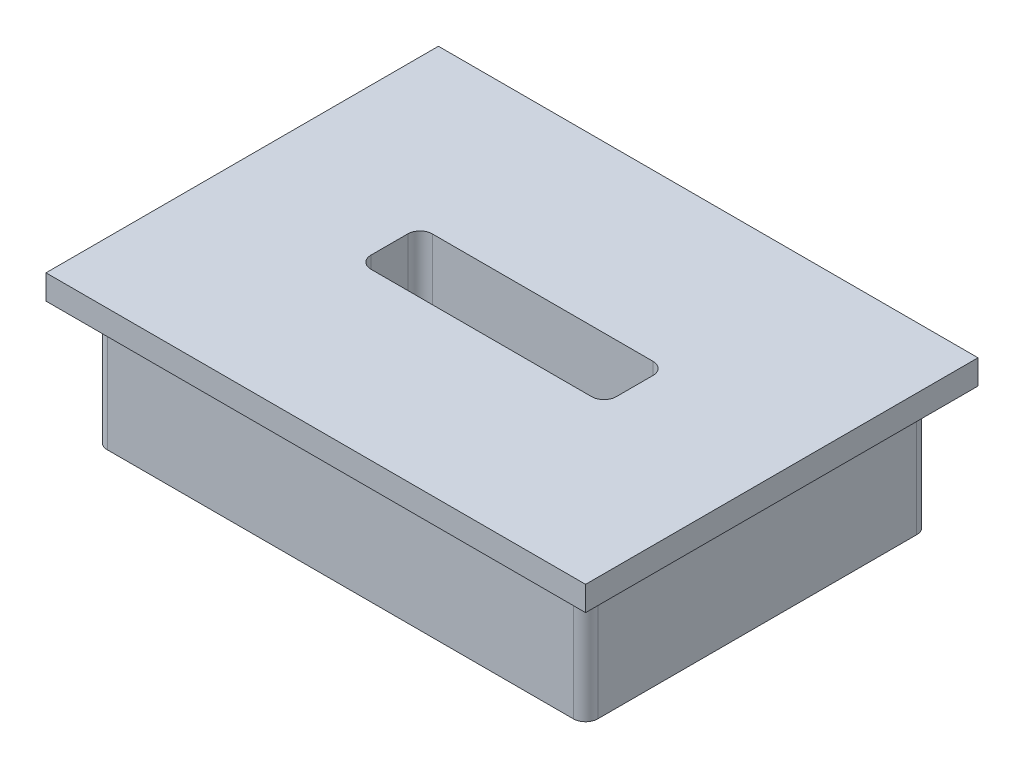
from build123d import *

# Parameters (mm, degrees)
SKETCH1_W           = 20
SKETCH1_H           = 14
SKETCH1_W_2         = 10
SKETCH1_H_2         = 2.5
BOSS_EXTRUDE1_DEPTH = 5
SKETCH2_W           = 22
SKETCH2_H           = 16
SKETCH2_W_2         = 10
SKETCH2_H_2         = 2.5
BOSS_EXTRUDE2_DEPTH = 1
FILLET1_R           = 0.5


with BuildPart() as part:
    # Sketch1 → Boss-Extrude1 (new body)
    with BuildSketch(Plane(origin=(0, 0, 0), x_dir=(1, 0, 0), z_dir=(0, 1, 0))):
        with Locations((10, -7)):
            Rectangle(SKETCH1_W, SKETCH1_H)
        with Locations((10, -7)):
            Rectangle(SKETCH1_W_2, SKETCH1_H_2, mode=Mode.SUBTRACT)
    extrude(amount=BOSS_EXTRUDE1_DEPTH)

    # Sketch2 → Boss-Extrude2 (add)
    with BuildSketch(Plane(origin=(0, 5, 0), x_dir=(1, 0, 0), z_dir=(0, 1, 0))):
        with Locations((10, -7)):
            Rectangle(SKETCH2_W, SKETCH2_H)
        with Locations((10, -7)):
            Rectangle(SKETCH2_W_2, SKETCH2_H_2, mode=Mode.SUBTRACT)
    extrude(amount=BOSS_EXTRUDE2_DEPTH)

    # Fillet1
    fillet1_edges = [part.edges().sort_by_distance(p)[0] for p in [
        (5, 3, 5.75),
        (15, 3, 5.75),
        (5, 3, 8.25),
        (15, 3, 8.25),
        (20, 2.5, 0),
        (0, 2.5, 0),
        (0, 2.5, 14),
        (20, 2.5, 14),
    ]]
    fillet(fillet1_edges, radius=FILLET1_R)


solid = part.part
